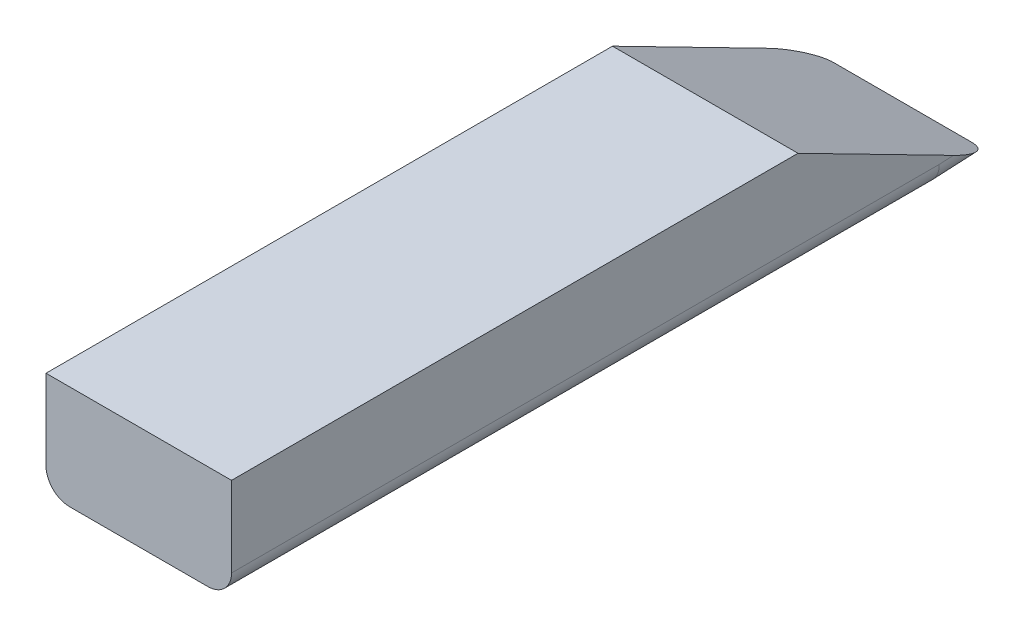
from build123d import *

# Parameters (mm, degrees)
BOSS_EXTRUDE1_DEPTH = 49.911
FILLET1_R           = 12.7


with BuildPart() as part:
    # Sketch1 → Boss-Extrude1 (new, symmetric)
    with BuildSketch(Plane(origin=(0, 0, 0), x_dir=(0, 0, -1), z_dir=(1, 0, 0))):
        Polygon((0, 0), (0, 55.88), (304.8, 55.88), (411.035788296, 1.516400562), (381.1016, 0), align=None)
    extrude(amount=BOSS_EXTRUDE1_DEPTH, both=True)

    # Fillet1
    # the kernel refuses this fillet: 12.7 mm, written as the material it takes off along each edge
    with BuildSketch(Plane(origin=(49.911, 0, -412.8516), x_dir=(0, 1, 0), z_dir=(0, 0, 1))) as fillet1_piece_1:
        with BuildLine():
            CenterArc((FILLET1_R, FILLET1_R), FILLET1_R, 180, 90)
            Line((0, FILLET1_R), (0, 0))
            Line((0, 0), (FILLET1_R, 0))
        make_face()
    extrude(amount=444.6016, mode=Mode.SUBTRACT)
    with BuildSketch(Plane(origin=(-49.911, 3.12272641, -442.745127887), x_dir=(1, 0, 0), z_dir=(0, -0.0505929400767125, 0.9987193571841863)), Plane(origin=(49.911, 3.12272641, -442.745127887), x_dir=(0, 0.9987193571841864, 0.0505929400767125), z_dir=(0, -0.0505929400767125, 0.9987193571841863))) as fillet1_piece_2:
        with BuildLine():
            CenterArc((FILLET1_R, FILLET1_R), FILLET1_R, 180, 90)
            Line((0, FILLET1_R), (0, 0))
            Line((0, 0), (FILLET1_R, 0))
        make_face()
    extrude(amount=93.472572456, mode=Mode.SUBTRACT)
    with BuildSketch(Plane(origin=(-49.911, 0, -412.8516), x_dir=(0, 1, 0), z_dir=(0, 0, 1))) as fillet1_piece_3:
        with BuildLine():
            CenterArc((FILLET1_R, -FILLET1_R), FILLET1_R, 90, 90)
            Line((0, -FILLET1_R), (0, 0))
            Line((0, 0), (FILLET1_R, 0))
        make_face()
    extrude(amount=444.6016, mode=Mode.SUBTRACT)


solid = part.part
